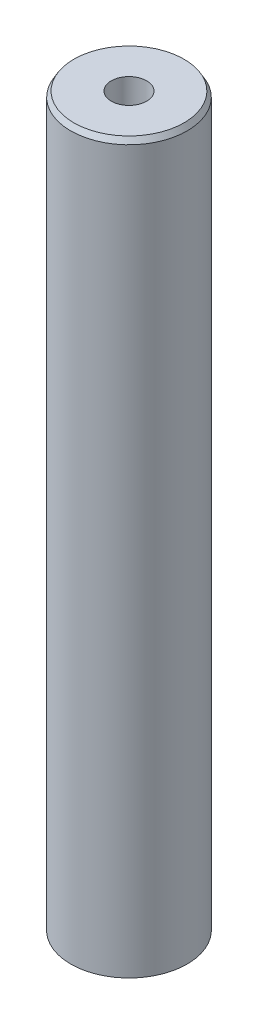
from build123d import *
from OCP.BRepFilletAPI import BRepFilletAPI_MakeChamfer

# Parameters (mm, degrees)
SKETCH1_R           = 35
BOSS_EXTRUDE1_DEPTH = 438.74152507
SKETCH2_R           = 10.632762268
CUT_EXTRUDE1_DEPTH  = 442.524773733
CHAMFER1_SIZE       = 3.259579362
CHAMFER1_SIZE2      = 1.881919022


with BuildPart() as part:
    # Sketch1 → Boss-Extrude1 (new body)
    with BuildSketch(Plane(origin=(0, 0, 0), x_dir=(1, 0, 0), z_dir=(0, 1, 0))):
        Circle(SKETCH1_R)
    extrude(amount=BOSS_EXTRUDE1_DEPTH)

    # Sketch2 → Cut-Extrude1 (cut, through all)
    with BuildSketch(Plane(origin=(0, 0, 0), x_dir=(1, 0, 0), z_dir=(0, 1, 0))):
        Circle(SKETCH2_R)
    extrude(amount=CUT_EXTRUDE1_DEPTH, mode=Mode.SUBTRACT)

    # Chamfer1: one chamfer whose edges measure the first distance from different faces: ONE call of the kernel's chamfer builder (chamfer() names one face for all edges)
    chamfer1_edges_1 = [part.edges().sort_by_distance(p)[0] for p in [
        (-35, 438.74152507, 0),
    ]]
    chamfer1_side_1 = [part.faces().sort_by_distance(p)[0] for p in [
        (-35, 219.370762535, 0),
    ]]
    chamfer1_edges_2 = [part.edges().sort_by_distance(p)[0] for p in [
        (-35, 0, 0),
    ]]
    chamfer1_side_2 = [part.faces().sort_by_distance(p)[0] for p in [
        (-34.010050506, 0, 0),
    ]]
    chamfer1 = BRepFilletAPI_MakeChamfer(part.part.solid().wrapped)
    for e in chamfer1_edges_1:
        chamfer1.Add(CHAMFER1_SIZE, CHAMFER1_SIZE2, e.wrapped, chamfer1_side_1[0].wrapped)  # the first distance lies on this face
    for e in chamfer1_edges_2:
        chamfer1.Add(CHAMFER1_SIZE, CHAMFER1_SIZE2, e.wrapped, chamfer1_side_2[0].wrapped)  # the first distance lies on this face
    add(Compound.cast(chamfer1.Shape()), mode=Mode.REPLACE)


solid = part.part
